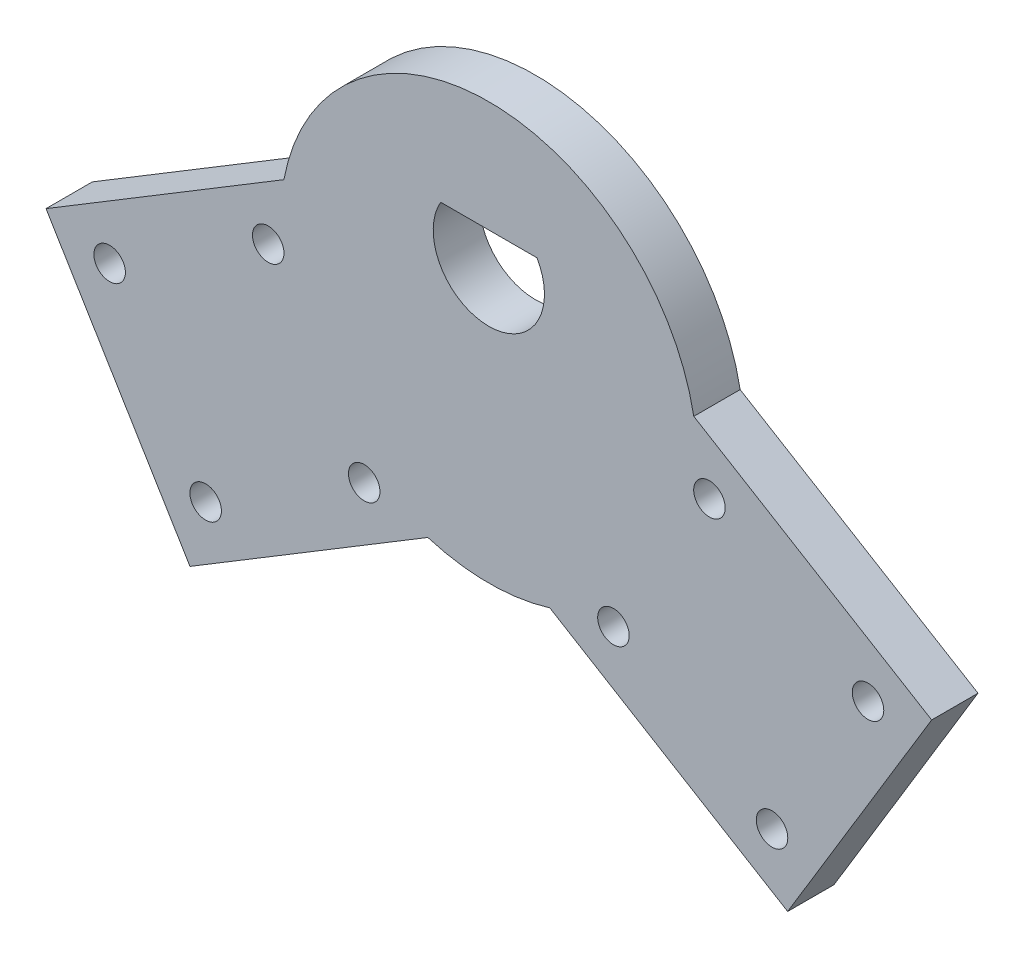
from build123d import *

# Parameters (mm, degrees)
BOSS_EXTRUDE1_DEPTH  = 5
M3_CLEARANCE_HOLE1_D = 3.4


with BuildPart() as part:
    # Sketch2 → Boss-Extrude1 (new body)
    with BuildSketch(Plane.XY):
        with BuildLine():
            Line((22.114553677, 4.146868175), (47.778278861, -11.389322146))
            Line((47.778278861, -11.389322146), (32.24208854, -37.05304733))
            Line((32.24208854, -37.05304733), (6.578363356, -21.516857009))
            ThreePointArc((6.578363356, -21.516857009), (0, -22.5), (-6.578363356, -21.516857009))
            Line((-6.578363356, -21.516857009), (-32.24208854, -37.05304733))
            Line((-32.24208854, -37.05304733), (-47.778278861, -11.389322146))
            Line((-47.778278861, -11.389322146), (-22.114553677, 4.146868175))
            ThreePointArc((-22.114553677, 4.146868175), (0, 22.5), (22.114553677, 4.146868175))
        make_face()
        with BuildLine():
            ThreePointArc((-5.196152423, 10.5), (0, 1.5), (5.196152423, 10.5))
            Line((5.196152423, 10.5), (-5.196152423, 10.5))
        make_face(mode=Mode.SUBTRACT)
    extrude(amount=BOSS_EXTRUDE1_DEPTH)

    # M3 Clearance Hole1 (through all)
    with Locations(Plane.XY.offset(5)):
        with Locations((-40.911626277, -13.077244623), (-23.802476154, -2.719784409), (-13.44501594, -19.828934532), (-30.554166063, -30.186394746), (13.44501594, -19.828934532), (23.802476154, -2.719784409), (40.911626277, -13.077244623), (30.554166063, -30.186394746)):
            Hole(M3_CLEARANCE_HOLE1_D / 2)


solid = part.part
